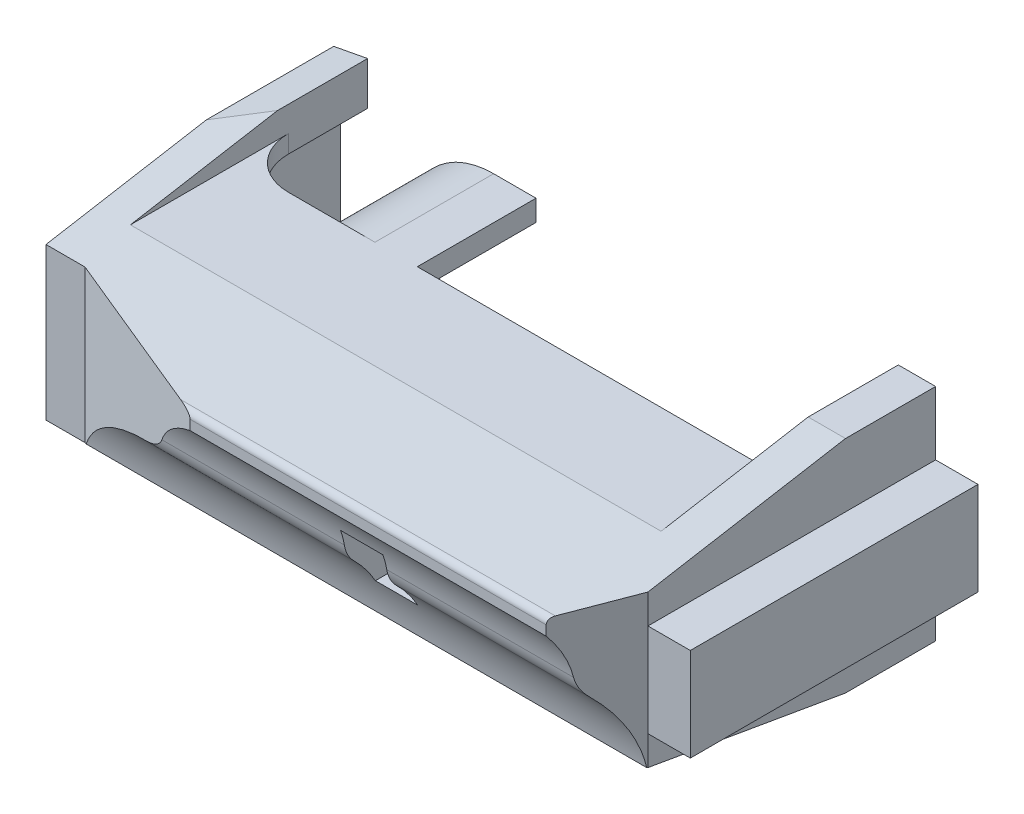
from build123d import *

# Parameters (mm, degrees)
BOSS_EXTRUDE1_DEPTH    = 34.29
SKETCH2_W              = 4.699
SKETCH2_H              = 1.424459459
SKETCH2_H_2            = 0.480540541
CUT_EXTRUDE1_DEPTH     = 60.774381845
SKETCH3_W              = 3.175
SKETCH3_H              = 4.572
CUT_EXTRUDE2_DEPTH     = 9.779
CUT_EXTRUDE3_DEPTH     = 70.085665402
CUT_EXTRUDE4_START     = -17.78
CUT_EXTRUDE4_OUTLINE_W = 7.62
CUT_EXTRUDE4_OUTLINE_H = 4.7625
CUT_EXTRUDE4_DEPTH     = 17.78
SKETCH6_W              = 10.915170011
SKETCH6_H              = 18.687954265
CUT_EXTRUDE5_DEPTH     = 74.422
CUT_EXTRUDE6_DEPTH     = 74.422
FILLET2_R              = 0.508
FILLET3_R              = 2.54


# Read off the part's stored shape, not the designer's step: Cut-Extrude4
with BuildPart() as part:
    # Sketch1 → Boss-Extrude1 (new body)
    with BuildSketch(Plane.XY):
        Polygon((9.398, 6.35), (9.398, -6.35), (9.398, -7.774459459), (11.938, -8.255), (11.938, -6.35), (51.689, -6.35), (51.689, -8.255), (54.483, -8.255), (54.483, -3.4925), (57.658, -3.4925), (57.658, 3.4925), (54.483, 3.4925), (54.483, 8.255), (51.689, 8.255), (51.689, 6.35), (11.938, 6.35), (11.938, 8.255), (9.398, 7.774459459), align=None)
    extrude(amount=-BOSS_EXTRUDE1_DEPTH)

    # Sketch2 → Cut-Extrude1 (cut, through all)
    with BuildSketch(Plane.ZY.offset(-9.398)):
        with BuildLine():
            ThreePointArc((11.962240433, -0.310327796), (7.428822396, 6.001266395), (0, 3.720762472))
            Line((0, 3.720762472), (0, 0.889))
            ThreePointArc((0, 0.889), (6.395096144, 1.80805092), (11.813233179, -1.711281452))
            ThreePointArc((11.813233179, -1.711281452), (11.924883856, -1.014755633), (11.962240433, -0.310327796))
        make_face()
        with BuildLine():
            Line((0, 0.889), (0, 3.720762472))
            ThreePointArc((0, 3.720762472), (-0.961463724, 1.954640839), (-1.351994264, -0.017942243))
            ThreePointArc((-1.351994264, -0.017942243), (-0.696131125, 0.465542965), (0, 0.889))
        make_face()
        with BuildLine():
            ThreePointArc((0, 0.889), (-0.696131125, 0.465542965), (-1.351994264, -0.017942243))
            ThreePointArc((-1.351994264, -0.017942243), (-1.054856668, -2.298153331), (0, -4.341418064))
            Line((0, -4.341418064), (0, 0.889))
        make_face()
        with BuildLine():
            ThreePointArc((11.813233179, -1.711281452), (6.395096144, 1.80805092), (0, 0.889))
            Line((0, 0.889), (0, -4.341418064))
            ThreePointArc((0, -4.341418064), (6.749348825, -6.811473452), (11.813233179, -1.711281452))
        make_face()
        with BuildLine():
            ThreePointArc((0, -4.341418064), (-1.054856668, -2.298153331), (-1.351994264, -0.017942243))
            ThreePointArc((-1.351994264, -0.017942243), (-3.994827922, -3.482124307), (-4.743817945, -7.774459459))
            Line((-4.743817945, -7.774459459), (0, -7.774459459))
            Line((0, -7.774459459), (0, -4.341418064))
        make_face()
        with Locations((-2.3495, 7.06222973)):
            Rectangle(SKETCH2_W, SKETCH2_H)
        with Locations((-2.3495, 8.01472973)):
            Rectangle(SKETCH2_W, SKETCH2_H_2)
        with BuildLine():
            Line((0, -7.774459459), (-4.743817945, -7.774459459))
            ThreePointArc((-4.743817945, -7.774459459), (-4.72456581, -8.015024154), (-4.699, -8.255))
            Line((-4.699, -8.255), (0, -8.255))
            Line((0, -8.255), (0, -7.774459459))
        make_face()
    extrude(amount=-CUT_EXTRUDE1_DEPTH, mode=Mode.SUBTRACT)

    # Sketch3 → Cut-Extrude2 (cut)
    with BuildSketch(Plane.XY):
        with Locations((36.7665, -0.381)):
            Rectangle(SKETCH3_W, SKETCH3_H)
    extrude(amount=-CUT_EXTRUDE2_DEPTH, mode=Mode.SUBTRACT)

    # Sketch4 → Cut-Extrude3 (cut, through all)
    with BuildSketch(Plane.XZ.offset(8.255)):
        with BuildLine():
            Line((51.689, -34.29), (51.689, -16.51))
            Line((51.689, -16.51), (40.767, -16.51))
            Line((40.767, -16.51), (40.767, -19.431))
            ThreePointArc((40.767, -19.431), (40.320630735, -20.508630735), (39.243, -20.955))
            Line((39.243, -20.955), (34.671, -20.955))
            ThreePointArc((34.671, -20.955), (33.593369265, -20.508630735), (33.147, -19.431))
            Line((33.147, -19.431), (33.147, -16.51))
            Line((33.147, -16.51), (25.4, -16.51))
            Line((25.4, -16.51), (25.4, -25.4))
            Line((25.4, -25.4), (15.875, -25.4))
            Line((15.875, -25.4), (15.875, -16.51))
            Line((15.875, -16.51), (15.748, -16.51))
            ThreePointArc((15.748, -16.51), (13.053923164, -17.625923164), (11.938, -20.32))
            Line((11.938, -20.32), (11.938, -34.29))
            Line((11.938, -34.29), (51.689, -34.29))
        make_face()
        with BuildLine():
            Line((35.179, -16.51), (38.354, -16.51))
            Line((38.354, -16.51), (38.354, -18.288))
            ThreePointArc((38.354, -18.288), (38.130815367, -18.826815367), (37.592, -19.05))
            Line((37.592, -19.05), (35.941, -19.05))
            ThreePointArc((35.941, -19.05), (35.402184633, -18.826815367), (35.179, -18.288))
            Line((35.179, -18.288), (35.179, -16.51))
        make_face()
        Polygon((57.658, -4.699), (54.483, -4.699), (51.562, 0), (57.658, 0), align=None)
        Polygon((6.604, -4.699), (12.319, -4.699), (24.892, 0), (6.604, 0), align=None)
    extrude(amount=-CUT_EXTRUDE3_DEPTH, mode=Mode.SUBTRACT)

    # Cut-Extrude4 outline → Cut-Extrude4 (cut)
    with BuildSketch(Plane(origin=(0, 0, -34.29), x_dir=(-1, 0, 0), z_dir=(0, 0, -1)).offset(CUT_EXTRUDE4_START)):
        with BuildLine():
            Line((-22.225, -6.35), (-15.875, -6.35))
            Line((-15.875, -6.35), (-15.875, -5.021000706))
            Line((-15.875, -5.021000706), (-11.938, -5.021000706))
            Line((-11.938, -5.021000706), (-9.906, -4.636568273))
            Line((-9.906, -4.636568273), (-9.906, 4.636568273))
            Line((-9.906, 4.636568273), (-11.938, 5.021000706))
            Line((-11.938, 5.021000706), (-15.875, 5.021000706))
            Line((-15.875, 5.021000706), (-15.875, 6.35))
            Line((-15.875, 6.35), (-22.225, 6.35))
            ThreePointArc((-22.225, 6.35), (-15.875, 0), (-22.225, -6.35))
        make_face()
        with Locations((-36.957, -3.96875)):
            Rectangle(CUT_EXTRUDE4_OUTLINE_W, CUT_EXTRUDE4_OUTLINE_H)
        with BuildLine():
            Line((-25.4, 4.7752), (-25.4, -4.7752))
            Line((-25.4, -4.7752), (-22.225, -4.7752))
            ThreePointArc((-22.225, -4.7752), (-17.4498, 0), (-22.225, 4.7752))
            Line((-22.225, 4.7752), (-25.4, 4.7752))
        make_face()
        with Locations((-36.957, 3.96875)):
            Rectangle(CUT_EXTRUDE4_OUTLINE_W, CUT_EXTRUDE4_OUTLINE_H)
        Polygon((-54.181998462, -1.397), (-51.689, -5.715), (-51.689, 5.715), (-54.181998462, 1.397), (-55.753, 1.397), (-55.753, -1.397), align=None)
    extrude(amount=CUT_EXTRUDE4_DEPTH, mode=Mode.SUBTRACT)

    # Sketch6 → Cut-Extrude5 (cut)
    with BuildSketch(Plane.ZY.offset(-9.398)):
        with Locations((-31.703953975, 0.006721575)):
            Rectangle(SKETCH6_W, SKETCH6_H)
    extrude(amount=-CUT_EXTRUDE5_DEPTH, mode=Mode.SUBTRACT)

    # Sketch7 → Cut-Extrude6 (cut)
    with BuildSketch(Plane.ZY.offset(-9.398)):
        Polygon((-19.4945, 8.255), (-19.4945, 8.707804747), (-4.699, 8.83298433), (3.124174595, 8.83298433), (3.124174595, 5.342724301), (3.124174595, 4.343051296), align=None)
        Polygon((3.124174595, -4.343051296), (3.124174595, -5.342724301), (3.124174595, -8.83298433), (-4.699, -8.83298433), (-19.4945, -8.707804747), (-19.4945, -8.255), align=None)
    extrude(amount=-CUT_EXTRUDE6_DEPTH, mode=Mode.SUBTRACT)

    # Fillet2
    fillet2_edges = [part.edges().sort_by_distance(p)[0] for p in [
        (38.227, 4.883384051, 0),
    ]]
    fillet(fillet2_edges, radius=FILLET2_R)

    # Fillet3
    fillet3_edges = [part.edges().sort_by_distance(p)[0] for p in [
        (45.378214433, -0.017942243, -1.351994264),
        (28.226750917, -0.017942243, -1.351994264),
    ]]
    fillet(fillet3_edges, radius=FILLET3_R)


solid = part.part
